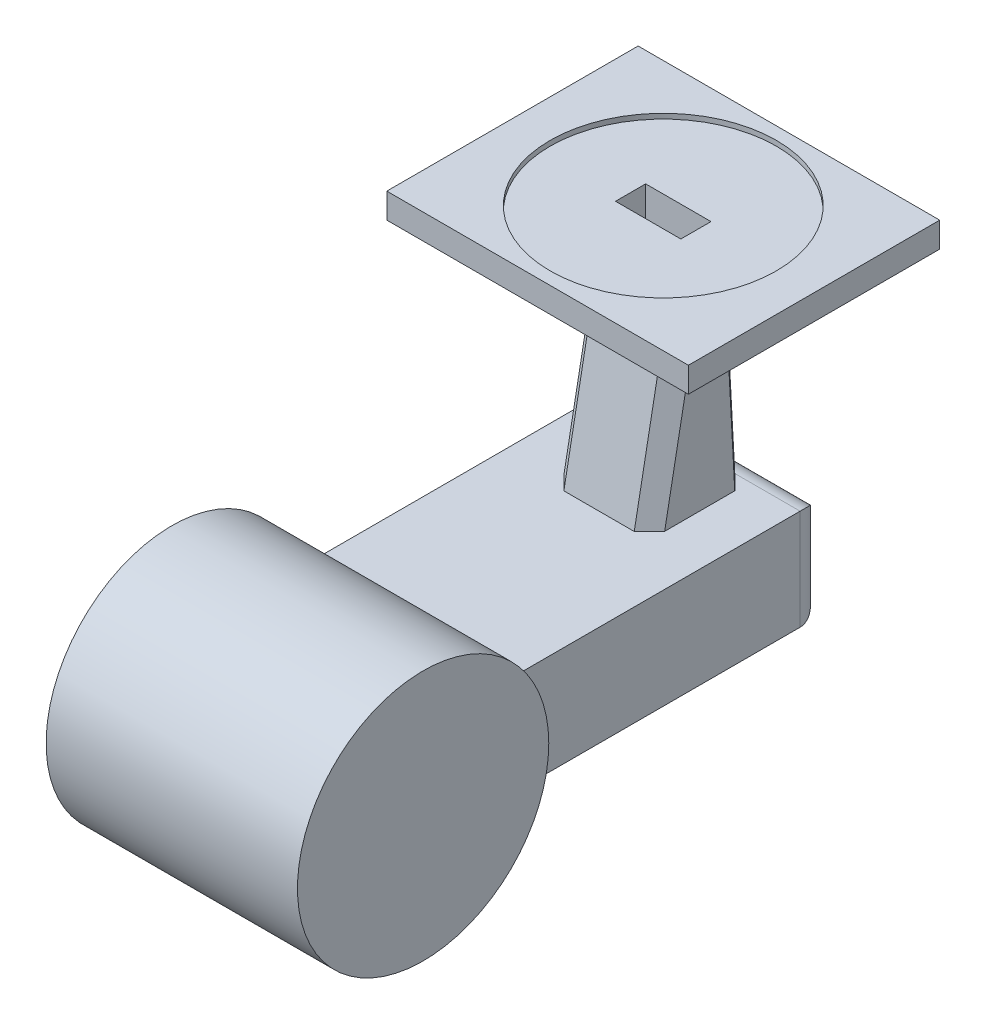
from build123d import *

# Parameters (mm, degrees)
BOSS_EXTRUDE1_DEPTH      = 25
BOSS_EXTRUDE1_DEPTH_BACK = 25
SKETCH1_R                = 25
BOSS_EXTRUDE4_DEPTH      = 20
BOSS_EXTRUDE4_DEPTH_BACK = 20
SKETCH9_W                = 85
SKETCH9_H                = 20
SHELL3_START             = -18
SHELL3_DEPTH             = 36
SHELL3_START_2           = -23
SHELL3_2_OUTLINE_R       = 23
SHELL3_2_DEPTH           = 46
FILLET2_R                = 5
BOSS_EXTRUDE5_DEPTH      = 10
BOSS_EXTRUDE5_DEPTH_BACK = 10
SKETCH5_W                = 60
SKETCH5_H                = 50
BOSS_EXTRUDE3_DEPTH      = 5
CUT_EXTRUDE2_REACH       = 112.881
CHAMFER2_SIZE            = 3
SKETCH13_R               = 22.5
CUT_EXTRUDE4_DEPTH       = 1
SKETCH15_W               = 13
SKETCH15_H               = 6
CUT_EXTRUDE10_DEPTH      = 119.931868873


# Read off the part's stored shape, not the designer's step: Shell3
with BuildPart() as part:
    # Sketch1 → Boss-Extrude1 (new, two sides: drawn at the far end of the back side and taken through both)
    with BuildSketch(Plane(origin=(0, 0, 0), x_dir=(0, 0, -1), z_dir=(1, 0, 0)).offset(-BOSS_EXTRUDE1_DEPTH_BACK)):
        with Locations((-56.501901141, -5)):
            Circle(SKETCH1_R)
    extrude(amount=BOSS_EXTRUDE1_DEPTH + BOSS_EXTRUDE1_DEPTH_BACK)

    # Sketch9 → Boss-Extrude4 (add, two sides: drawn at the far end of the back side and taken through both)
    with BuildSketch(Plane(origin=(0, 0, 0), x_dir=(0, 0, -1), z_dir=(1, 0, 0)).offset(-BOSS_EXTRUDE4_DEPTH_BACK)):
        with Locations((-14.001901141, -5)):
            Rectangle(SKETCH9_W, SKETCH9_H)
    extrude(amount=BOSS_EXTRUDE4_DEPTH + BOSS_EXTRUDE4_DEPTH_BACK)

    # Shell3 outline → Shell3 (cut)
    with BuildSketch(Plane.YZ.offset(SHELL3_START)):
        with BuildLine():
            ThreePointArc((3, 34.938042488), (-5, 79.501901141), (-13, 34.938042488))
            Line((-13, 34.938042488), (-13, -26.498098859))
            Line((-13, -26.498098859), (3, -26.498098859))
            Line((3, -26.498098859), (3, 34.938042488))
        make_face()
    extrude(amount=SHELL3_DEPTH, mode=Mode.SUBTRACT)

    # Shell3 2 outline → Shell3 2 (cut)
    with BuildSketch(Plane.YZ.offset(SHELL3_START_2)):
        with Locations((-5, 56.501901141)):
            Circle(SHELL3_2_OUTLINE_R)
    extrude(amount=SHELL3_2_DEPTH, mode=Mode.SUBTRACT)

    # Fillet2
    fillet2_edges = [part.edges().sort_by_distance(p)[0] for p in [
        (0, 5, -28.498098859),
        (-20, -5, -28.498098859),
        (0, -15, -28.498098859),
        (20, -5, -28.498098859),
    ]]
    fillet(fillet2_edges, radius=FILLET2_R)

    # Sketch11 → Boss-Extrude5 (add, two sides: drawn at the far end of the back side and taken through both)
    with BuildSketch(Plane.ZY.offset(-BOSS_EXTRUDE5_DEPTH_BACK)):
        Polygon((-3.498098859, 5), (-11.271686446, 46.254104782), (-21.271686446, 46.254104782), (-23.498098859, 5), align=None)
    extrude(amount=BOSS_EXTRUDE5_DEPTH + BOSS_EXTRUDE5_DEPTH_BACK)

    # Sketch5 → Boss-Extrude3 (add)
    with BuildSketch(Plane(origin=(0, 46.254104782, 0), x_dir=(1, 0, 0), z_dir=(0, 1, 0))):
        with Locations((0, 16.271686446)):
            Rectangle(SKETCH5_W, SKETCH5_H)
    extrude(amount=BOSS_EXTRUDE3_DEPTH)

    # Sketch8 → Cut-Extrude2 (cut, up to next)
    with BuildSketch(Plane.ZY.offset(25), mode=Mode.PRIVATE) as cut_extrude2_sk1:
        Polygon((56.501901141, 12.320508076), (41.501901141, 3.660254038), (41.501901141, -13.660254038), (56.501901141, -22.320508076), (71.501901141, -13.660254038), (71.501901141, 3.660254038), align=None)
    cut_extrude2_tool1 = extrude(cut_extrude2_sk1.sketch, amount=-CUT_EXTRUDE2_REACH, mode=Mode.PRIVATE) & part.part
    add(cut_extrude2_tool1.solids().sort_by_distance((-25, -5, 56.501901))[0], mode=Mode.SUBTRACT)

    # Chamfer2
    chamfer2_edges = [part.edges().sort_by_distance(p)[0] for p in [
        (10, 25.627052391, -22.384892652),
        (10, 25.627052391, -7.384892652),
        (-10, 25.627052391, -7.384892652),
        (-10, 25.627052391, -22.384892652),
    ]]
    chamfer(chamfer2_edges, length=CHAMFER2_SIZE)

    # Sketch13 → Cut-Extrude4 (cut)
    with BuildSketch(Plane(origin=(0, 51.254104782, 0), x_dir=(1, 0, 0), z_dir=(0, 1, 0))):
        with Locations(Location((0, 16.271686446, 0), (0, 0, 270))):
            Circle(SKETCH13_R)
    extrude(amount=-CUT_EXTRUDE4_DEPTH, mode=Mode.SUBTRACT)

    # Sketch15 → Cut-Extrude10 (cut, through all)
    with BuildSketch(Plane(origin=(0, 51.254104782, 0), x_dir=(1, 0, 0), z_dir=(0, 1, 0))):
        with Locations((0, 16.271686446)):
            Rectangle(SKETCH15_W, SKETCH15_H)
    extrude(amount=-CUT_EXTRUDE10_DEPTH, mode=Mode.SUBTRACT)


solid = part.part
